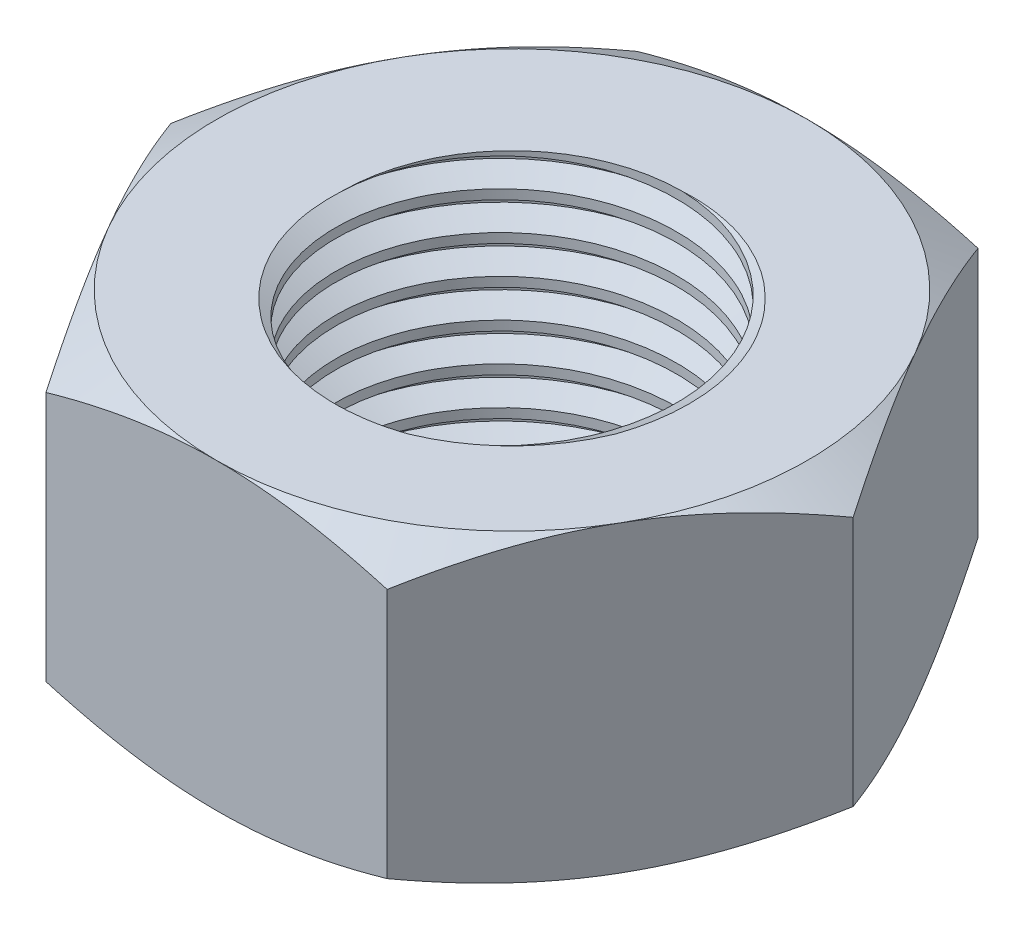
from build123d import *

# Parameters (mm, degrees)
BOSS_EXTRUDE1_DEPTH    = 8
M10X1_0_TAPPED_HOLE1_D = 9
THREAD1_PITCH          = 1


with BuildPart() as part:
    # Sketch1 → Boss-Extrude1 (new body)
    with BuildSketch(Plane(origin=(0, 0, 0), x_dir=(1, 0, 0), z_dir=(0, 1, 0))):
        Polygon((4.5, -7.794228634), (9, 0), (4.5, 7.794228634), (-4.5, 7.794228634), (-9, 0), (-4.5, -7.794228634), align=None)
    extrude(amount=BOSS_EXTRUDE1_DEPTH)

    # Sketch2 → Cut-Revolve1 (revolve, cut)
    with BuildSketch(Plane(origin=(0, 0, 0), x_dir=(0, 0, -1), z_dir=(1, 0, 0))):
        Polygon((7.794228634, 0), (10.151715365, 1.361095599), (10.151715365, 0), align=None)
        Polygon((10.151715365, 6.638904401), (10.151715365, 8), (7.794228634, 8), align=None)
    revolve(axis=Axis((0, 0, 0), (0, -1, 0)), mode=Mode.SUBTRACT)

    # M10x1.0 Tapped Hole1 (through all)
    with Locations(Plane(origin=(0, 8, 0), x_dir=(1, 0, 0), z_dir=(0, 1, 0))):
        with Locations((0, 0)):
            Hole(M10X1_0_TAPPED_HOLE1_D / 2)

    # Thread1: the profile of Thread Profile1 profile screwed along a right-hand helix of 9 turns, 8 arcs to a turn; built about Z, then put on its axis
    thread1_z = Axis((0, 0, 0), (0, 0, 1))
    thread1_corners = [(4.4997, 0, -0.000173205), (5.041265875, 0, 0.312499999), (5.041265875, 0, 0.437499999), (4.4997, 0, 0.750173202)]
    with BuildLine(mode=Mode.PRIVATE) as thread1_profile:
        Line(thread1_corners[0], thread1_corners[1])
        Line(thread1_corners[1], thread1_corners[2])
        Line(thread1_corners[2], thread1_corners[3])
        Line(thread1_corners[3], thread1_corners[0])
    thread1_cap = Face(thread1_profile.wire())
    thread1_turn_angles = [0, 22.5, 45, 67.5, 90, 112.5, 135, 157.5, 180, 202.5, 225, 247.5, 270, 292.5, 315, 337.5, 360]
    thread1_turn_weights = [1, 0.9238795325112867, 1, 0.9238795325112867, 1, 0.9238795325112867, 1, 0.9238795325112867, 1, 0.9238795325112867, 1, 0.9238795325112867, 1, 0.9238795325112867, 1, 0.9238795325112867, 1]
    thread1_turn_rails = [Edge.make_bspline([Vector(p[0], p[1], 0).rotate(thread1_z, thread1_turn_angles[k]) / thread1_turn_weights[k] + Vector(0, 0, p[2] + THREAD1_PITCH * thread1_turn_angles[k] / 360) for k in range(17)], [0, 0, 0, 1, 1, 2, 2, 3, 3, 4, 4, 5, 5, 6, 6, 7, 7, 8, 8, 8], 2, thread1_turn_weights) for p in thread1_corners]
    thread1_turn_sides = [Face.make_surface_from_curves(thread1_turn_rails[p[0]], thread1_turn_rails[p[1]]) for p in [(0, 1), (1, 2), (2, 3), (3, 0)]]
    thread1 = Plane(origin=(0, 9, 0), x_dir=(-1, 0, 0), z_dir=(0, -1, 0)) * Solid(Shell([*[p.moved(Location((0, 0, THREAD1_PITCH * i))) for i in range(9) for p in thread1_turn_sides], thread1_cap, thread1_cap.rotate(thread1_z, 3240).moved(Location((0, 0, THREAD1_PITCH * 3240 / 360)))]))
    add(thread1, mode=Mode.SUBTRACT)


solid = part.part
